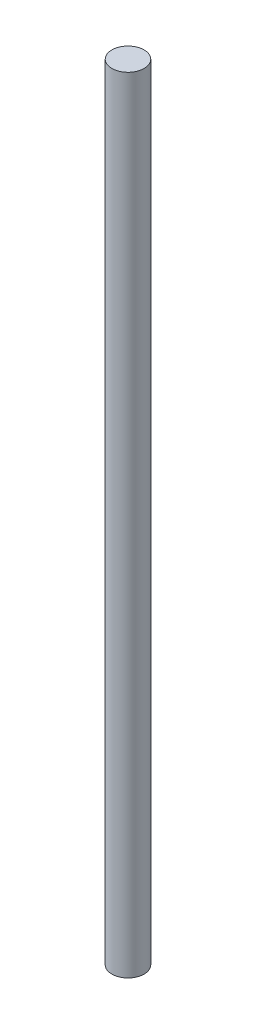
from build123d import *

# Parameters (mm, degrees)
SKETCH1_R           = 2
BOSS_EXTRUDE1_DEPTH = 97.4


with BuildPart() as part:
    # Sketch1 → Boss-Extrude1 (new body)
    with BuildSketch(Plane(origin=(0, 0, 0), x_dir=(1, 0, 0), z_dir=(0, 1, 0))):
        Circle(SKETCH1_R)
    extrude(amount=BOSS_EXTRUDE1_DEPTH)


solid = part.part
